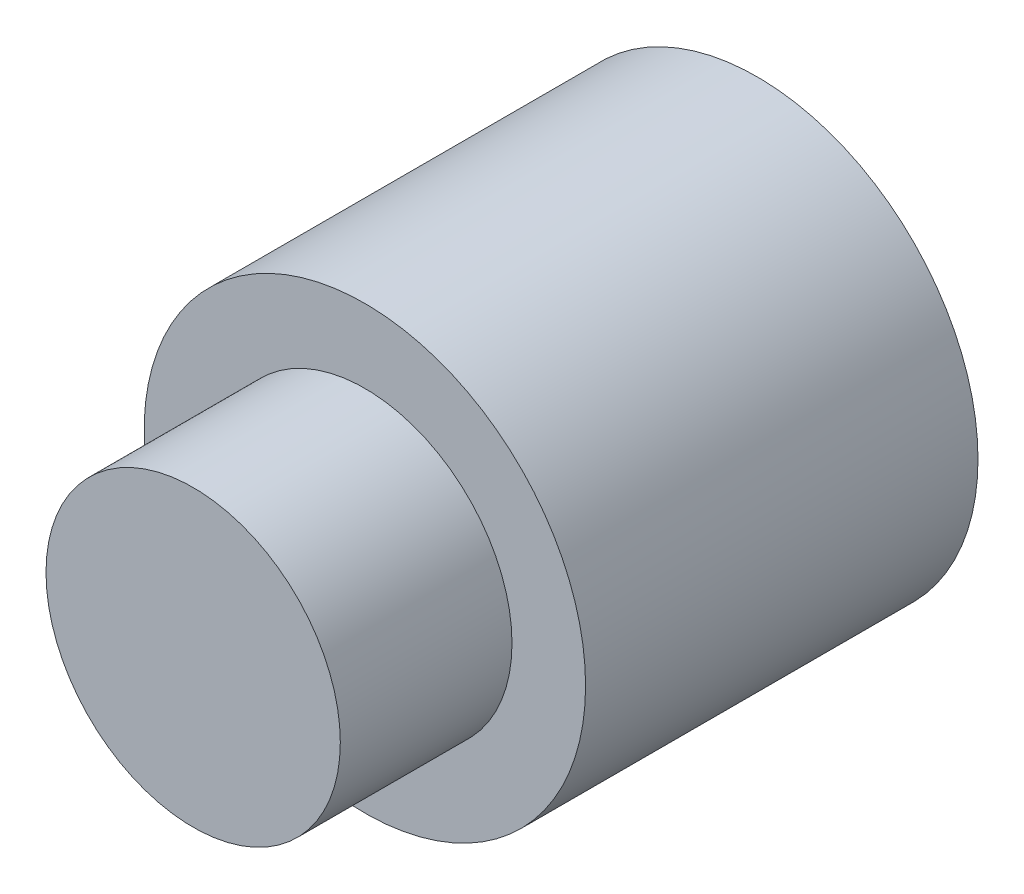
from build123d import *

# Parameters (mm, degrees)
SKETCH_1_R      = 4.5
EXTRUDE_1_DEPTH = 8
SKETCH_2_R      = 3
EXTRUDE_2_DEPTH = 3.5


with BuildPart() as part:
    # Эскиз1 → Бобышка-Вытянуть1 (new body)
    with BuildSketch(Plane.XY):
        Circle(SKETCH_1_R)
    extrude(amount=EXTRUDE_1_DEPTH)

    # Эскиз2 → Бобышка-Вытянуть2 (add)
    with BuildSketch(Plane.XY.offset(8)):
        Circle(SKETCH_2_R)
    extrude(amount=EXTRUDE_2_DEPTH)


solid = part.part
